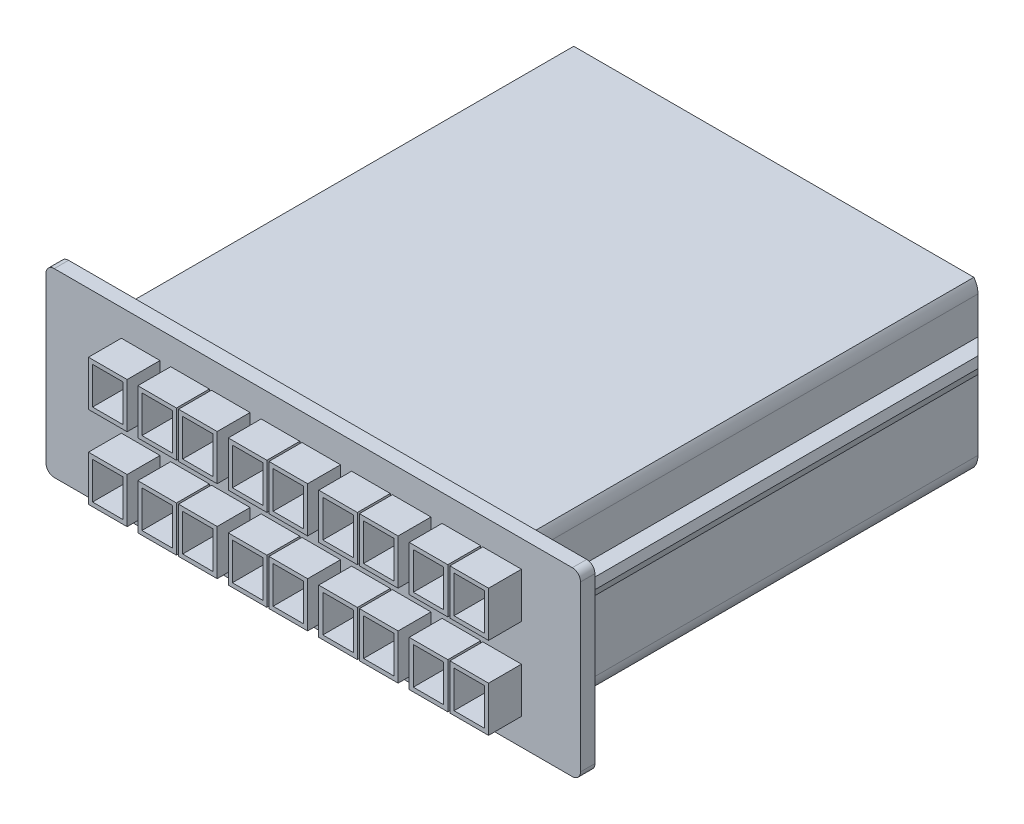
from build123d import *

# Parameters (mm, degrees)
EXTRUDE_1_DEPTH      = 22
EXTRUDE_1_DEPTH_BACK = 22
SKETCH_1_W           = 130
SKETCH_1_H           = 112
SKETCH_2_W           = 10.341275007
SKETCH_2_H           = 108.506204724
CUT_EXTRUDE_1_DEPTH  = 97.42095208
SKETCH_3_W           = 108.506204724
SKETCH_3_H           = 14.039795579
SKETCH_3_H_2         = 26.032937215
CUT_EXTRUDE_2_DEPTH  = 5
CHAMFER_1_SIZE       = 5
FILLET_1_R           = 5
CHAMFER_2_SIZE       = 2.747477419
CHAMFER_2_SIZE_2     = 1
FILLET_2_R           = 2
SKETCH_4_W           = 9.4
SKETCH_4_H           = 11
SKETCH_4_W_2         = 7.4
SKETCH_4_H_2         = 9
EXTRUDE_2_DEPTH      = 8
SKETCH_5_W           = 122.805441914
SKETCH_5_H           = 111.758877205
CUT_EXTRUDE_3_DEPTH  = 2


with BuildPart() as part:
    # 草图1 → 凸台-拉伸1 (new, two sides: drawn at the far end of the back side and taken through both)
    with BuildSketch(Plane(origin=(0, 0, 0), x_dir=(1, 0, 0), z_dir=(0, 1, 0)).offset(-EXTRUDE_1_DEPTH_BACK)):
        Rectangle(SKETCH_1_W, SKETCH_1_H)
    extrude(amount=EXTRUDE_1_DEPTH + EXTRUDE_1_DEPTH_BACK)

    # 草图2 → 切除-拉伸1 (cut, through all)
    with BuildSketch(Plane(origin=(0, 22, 0), x_dir=(1, 0, 0), z_dir=(0, 1, 0))):
        with Locations((59.829362496, 1.746897638)):
            Rectangle(SKETCH_2_W, SKETCH_2_H)
        with Locations((-59.829362496, 1.746897638)):
            Rectangle(SKETCH_2_W, SKETCH_2_H)
    extrude(amount=-CUT_EXTRUDE_1_DEPTH, mode=Mode.SUBTRACT)

    # 草图3 → 切除-拉伸2 (cut)
    with BuildSketch(Plane.ZY.offset(54.658724993)):
        with Locations((-1.746897638, 14.980102211)):
            Rectangle(SKETCH_3_W, SKETCH_3_H)
        with Locations((-1.746897638, -8.983531392)):
            Rectangle(SKETCH_3_W, SKETCH_3_H_2)
    cut_extrude_2 = extrude(amount=-CUT_EXTRUDE_2_DEPTH, mode=Mode.SUBTRACT)

    # 镜向1: 切除-拉伸2 across plane
    add(cut_extrude_2.mirror(Plane(origin=(0, 0, 0), x_dir=(0, 0, 1), z_dir=(1, 0, 0))), mode=Mode.SUBTRACT)

    # 倒角1
    chamfer_1_edges = [part.edges().sort_by_distance(p)[0] for p in [
        (-54.658724993, 5.996570818, -56),
        (54.658724993, 5.996570818, -56),
    ]]
    chamfer(chamfer_1_edges, length=CHAMFER_1_SIZE)

    # 圆角1
    fillet_1_edges = [part.edges().sort_by_distance(p)[0] for p in [
        (-49.658724993, 22, -1.746897638),
        (-49.658724993, -22, -1.746897638),
        (49.658724993, 22, -1.746897638),
        (49.658724993, -22, -1.746897638),
    ]]
    fillet(fillet_1_edges, radius=FILLET_1_R)

    # 倒角2
    # the kernel refuses this chamfer: 2.747477419, 1 mm, written as the material it takes off along each edge
    with BuildSketch(Plane(origin=(54.658724993, 7.960204421, 52.506204724), x_dir=(0.013184058198646332, -0.9999130865277316, 0), z_dir=(0, 0, -1))) as chamfer_2_piece_1:
        Polygon((CHAMFER_2_SIZE * 0.999913086693, CHAMFER_2_SIZE * 0.0131840582008), (-CHAMFER_2_SIZE_2 * 0.0131840581986, CHAMFER_2_SIZE_2 * 0.999913086528), (0, 0), align=None)
    extrude(amount=110.633696174, mode=Mode.SUBTRACT)
    with BuildSketch(Plane(origin=(54.658724993, 4.032937215, 52.506204724), x_dir=(-0.9950833631817486, -0.09904090225205064, 0), z_dir=(0, 0, -1))) as chamfer_2_piece_2:
        Polygon((CHAMFER_2_SIZE_2 * 0.995083363182, CHAMFER_2_SIZE_2 * 0.0990409022521), (-CHAMFER_2_SIZE * 0.0990409022684, CHAMFER_2_SIZE * 0.995083363346), (0, 0), align=None)
    extrude(amount=110.633696174, mode=Mode.SUBTRACT)
    with BuildSketch(Plane(origin=(-54.658724993, 4.032937215, 52.506204724), x_dir=(0.9999130865277316, -0.0131840581986457, 0), z_dir=(0, 0, -1))) as chamfer_2_piece_3:
        Polygon((CHAMFER_2_SIZE * 0.999913086693, -CHAMFER_2_SIZE * 0.0131840582008), (-CHAMFER_2_SIZE_2 * 0.0131840581986, -CHAMFER_2_SIZE_2 * 0.999913086528), (0, 0), align=None)
    extrude(amount=110.633696174, mode=Mode.SUBTRACT)
    with BuildSketch(Plane(origin=(-54.658724993, 7.960204421, 52.506204724), x_dir=(-0.09904090225204945, -0.9950833631817486, 0), z_dir=(0, 0, -1))) as chamfer_2_piece_4:
        Polygon((CHAMFER_2_SIZE_2 * 0.995083363182, -CHAMFER_2_SIZE_2 * 0.099040902252), (-CHAMFER_2_SIZE * 0.0990409022684, -CHAMFER_2_SIZE * 0.995083363346), (0, 0), align=None)
    extrude(amount=110.633696174, mode=Mode.SUBTRACT)

    # 圆角2
    fillet_2_edges = [part.edges().sort_by_distance(p)[0] for p in [
        (65, -22, 54.253102362),
        (65, 22, 54.253102362),
        (-65, 22, 54.253102362),
        (-65, -22, 54.253102362),
    ]]
    fillet(fillet_2_edges, radius=FILLET_2_R)

    # 草图4 → 凸台-拉伸2 (add)
    # profile 1 of 18: a face of its own
    with BuildSketch(Plane.XY.offset(56)):
        with Locations((-29.973556768, -10)):
            Rectangle(SKETCH_4_W, SKETCH_4_H)
        with Locations((-29.973556768, -10)):
            Rectangle(SKETCH_4_W_2, SKETCH_4_H_2, mode=Mode.SUBTRACT)
    # profile 2 of 18: a face of its own
    with BuildSketch(Plane.XY.offset(56)):
        with Locations((-41.973556768, -10)):
            Rectangle(SKETCH_4_W, SKETCH_4_H)
        with Locations((-41.973556768, -10)):
            Rectangle(SKETCH_4_W_2, SKETCH_4_H_2, mode=Mode.SUBTRACT)
    # profile 3 of 18: a face of its own
    with BuildSketch(Plane.XY.offset(56)):
        with Locations((-20.073556768, -10)):
            Rectangle(SKETCH_4_W, SKETCH_4_H)
        with Locations((-20.073556768, -10)):
            Rectangle(SKETCH_4_W_2, SKETCH_4_H_2, mode=Mode.SUBTRACT)
    # profile 4 of 18: a face of its own
    with BuildSketch(Plane.XY.offset(56)):
        with Locations((-7.973556768, -10)):
            Rectangle(SKETCH_4_W, SKETCH_4_H)
        with Locations((-7.973556768, -10)):
            Rectangle(SKETCH_4_W_2, SKETCH_4_H_2, mode=Mode.SUBTRACT)
    # profile 5 of 18: a face of its own
    with BuildSketch(Plane.XY.offset(56)):
        with Locations((1.926443232, -10)):
            Rectangle(SKETCH_4_W, SKETCH_4_H)
        with Locations((1.926443232, -10)):
            Rectangle(SKETCH_4_W_2, SKETCH_4_H_2, mode=Mode.SUBTRACT)
    # profile 6 of 18: a face of its own
    with BuildSketch(Plane.XY.offset(56)):
        with Locations((14.026443232, -10)):
            Rectangle(SKETCH_4_W, SKETCH_4_H)
        with Locations((14.026443232, -10)):
            Rectangle(SKETCH_4_W_2, SKETCH_4_H_2, mode=Mode.SUBTRACT)
    # profile 7 of 18: a face of its own
    with BuildSketch(Plane.XY.offset(56)):
        with Locations((23.926443232, -10)):
            Rectangle(SKETCH_4_W, SKETCH_4_H)
        with Locations((23.926443232, -10)):
            Rectangle(SKETCH_4_W_2, SKETCH_4_H_2, mode=Mode.SUBTRACT)
    # profile 8 of 18: a face of its own
    with BuildSketch(Plane.XY.offset(56)):
        with Locations((36.026443232, -10)):
            Rectangle(SKETCH_4_W, SKETCH_4_H)
        with Locations((36.026443232, -10)):
            Rectangle(SKETCH_4_W_2, SKETCH_4_H_2, mode=Mode.SUBTRACT)
    # profile 9 of 18: a face of its own
    with BuildSketch(Plane.XY.offset(56)):
        with Locations((45.926443232, -10)):
            Rectangle(SKETCH_4_W, SKETCH_4_H)
        with Locations((45.926443232, -10)):
            Rectangle(SKETCH_4_W_2, SKETCH_4_H_2, mode=Mode.SUBTRACT)
    # profile 10 of 18: a face of its own
    with BuildSketch(Plane.XY.offset(56)):
        with Locations((45.926443232, 10)):
            Rectangle(SKETCH_4_W, SKETCH_4_H)
        with Locations((45.926443232, 10)):
            Rectangle(SKETCH_4_W_2, SKETCH_4_H_2, mode=Mode.SUBTRACT)
    # profile 11 of 18: a face of its own
    with BuildSketch(Plane.XY.offset(56)):
        with Locations((36.026443232, 10)):
            Rectangle(SKETCH_4_W, SKETCH_4_H)
        with Locations((36.026443232, 10)):
            Rectangle(SKETCH_4_W_2, SKETCH_4_H_2, mode=Mode.SUBTRACT)
    # profile 12 of 18: a face of its own
    with BuildSketch(Plane.XY.offset(56)):
        with Locations((23.926443232, 10)):
            Rectangle(SKETCH_4_W, SKETCH_4_H)
        with Locations((23.926443232, 10)):
            Rectangle(SKETCH_4_W_2, SKETCH_4_H_2, mode=Mode.SUBTRACT)
    # profile 13 of 18: a face of its own
    with BuildSketch(Plane.XY.offset(56)):
        with Locations((14.026443232, 10)):
            Rectangle(SKETCH_4_W, SKETCH_4_H)
        with Locations((14.026443232, 10)):
            Rectangle(SKETCH_4_W_2, SKETCH_4_H_2, mode=Mode.SUBTRACT)
    # profile 14 of 18: a face of its own
    with BuildSketch(Plane.XY.offset(56)):
        with Locations((1.926443232, 10)):
            Rectangle(SKETCH_4_W, SKETCH_4_H)
        with Locations((1.926443232, 10)):
            Rectangle(SKETCH_4_W_2, SKETCH_4_H_2, mode=Mode.SUBTRACT)
    # profile 15 of 18: a face of its own
    with BuildSketch(Plane.XY.offset(56)):
        with Locations((-7.973556768, 10)):
            Rectangle(SKETCH_4_W, SKETCH_4_H)
        with Locations((-7.973556768, 10)):
            Rectangle(SKETCH_4_W_2, SKETCH_4_H_2, mode=Mode.SUBTRACT)
    # profile 16 of 18: a face of its own
    with BuildSketch(Plane.XY.offset(56)):
        with Locations((-20.073556768, 10)):
            Rectangle(SKETCH_4_W, SKETCH_4_H)
        with Locations((-20.073556768, 10)):
            Rectangle(SKETCH_4_W_2, SKETCH_4_H_2, mode=Mode.SUBTRACT)
    # profile 17 of 18: a face of its own
    with BuildSketch(Plane.XY.offset(56)):
        with Locations((-29.973556768, 10)):
            Rectangle(SKETCH_4_W, SKETCH_4_H)
        with Locations((-29.973556768, 10)):
            Rectangle(SKETCH_4_W_2, SKETCH_4_H_2, mode=Mode.SUBTRACT)
    # profile 18 of 18: a face of its own
    with BuildSketch(Plane.XY.offset(56)):
        with Locations((-41.973556768, 10)):
            Rectangle(SKETCH_4_W, SKETCH_4_H)
        with Locations((-41.973556768, 10)):
            Rectangle(SKETCH_4_W_2, SKETCH_4_H_2, mode=Mode.SUBTRACT)
    extrude(amount=EXTRUDE_2_DEPTH)

    # 草图5 → 切除-拉伸3 (cut)
    with BuildSketch(Plane(origin=(0, 22, 0), x_dir=(1, 0, 0), z_dir=(0, 1, 0))):
        with Locations((1.597279043, 3.373233879)):
            Rectangle(SKETCH_5_W, SKETCH_5_H)
    cut_extrude_3 = extrude(amount=-CUT_EXTRUDE_3_DEPTH, mode=Mode.SUBTRACT)

    # 镜向2: 切除-拉伸3 across plane
    add(cut_extrude_3.mirror(Plane.ZX), mode=Mode.SUBTRACT)


solid = part.part
